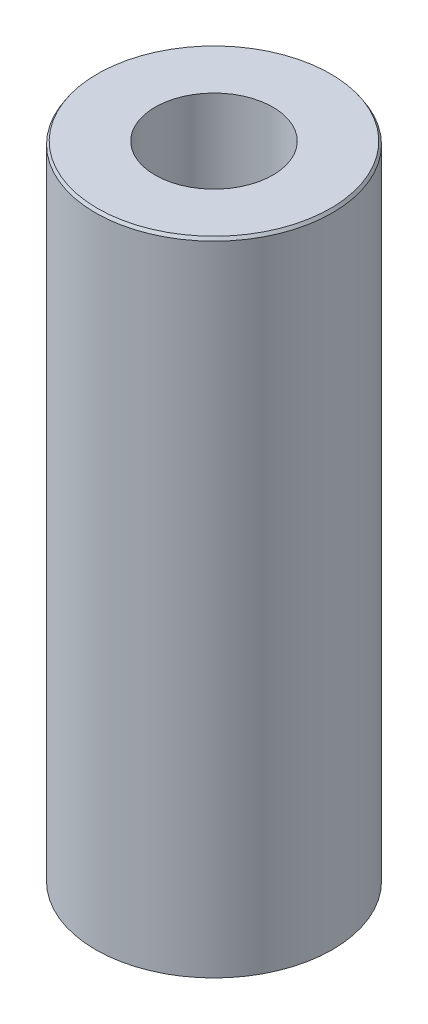
from build123d import *
from OCP.BRepFilletAPI import BRepFilletAPI_MakeChamfer

# Parameters (mm, degrees)
SKETCH1_R           = 50
BOSS_EXTRUDE1_DEPTH = 271.383393235
SKETCH2_R           = 24.863854055
CUT_EXTRUDE1_DEPTH  = 281.444194313
CHAMFER1_SIZE       = 1.239280265
CHAMFER1_SIZE2      = 0.801640604


with BuildPart() as part:
    # Sketch1 → Boss-Extrude1 (new body)
    with BuildSketch(Plane(origin=(0, 0, 0), x_dir=(1, 0, 0), z_dir=(0, 1, 0))):
        Circle(SKETCH1_R)
    extrude(amount=BOSS_EXTRUDE1_DEPTH)

    # Sketch2 → Cut-Extrude1 (cut, through all)
    with BuildSketch(Plane(origin=(0, 0, 0), x_dir=(1, 0, 0), z_dir=(0, 1, 0))):
        Circle(SKETCH2_R)
    extrude(amount=CUT_EXTRUDE1_DEPTH, mode=Mode.SUBTRACT)

    # Chamfer1: one chamfer whose edges measure the first distance from different faces: ONE call of the kernel's chamfer builder (chamfer() names one face for all edges)
    chamfer1_edges_1 = [part.edges().sort_by_distance(p)[0] for p in [
        (-50, 271.383393235, 0),
    ]]
    chamfer1_side_1 = [part.faces().sort_by_distance(p)[0] for p in [
        (-50, 135.691696617, 0),
    ]]
    chamfer1_edges_2 = [part.edges().sort_by_distance(p)[0] for p in [
        (-50, 0, 0),
    ]]
    chamfer1_side_2 = [part.faces().sort_by_distance(p)[0] for p in [
        (-48.585786438, 0, 0),
    ]]
    chamfer1 = BRepFilletAPI_MakeChamfer(part.part.solid().wrapped)
    for e in chamfer1_edges_1:
        chamfer1.Add(CHAMFER1_SIZE, CHAMFER1_SIZE2, e.wrapped, chamfer1_side_1[0].wrapped)  # the first distance lies on this face
    for e in chamfer1_edges_2:
        chamfer1.Add(CHAMFER1_SIZE, CHAMFER1_SIZE2, e.wrapped, chamfer1_side_2[0].wrapped)  # the first distance lies on this face
    add(Compound.cast(chamfer1.Shape()), mode=Mode.REPLACE)


solid = part.part
